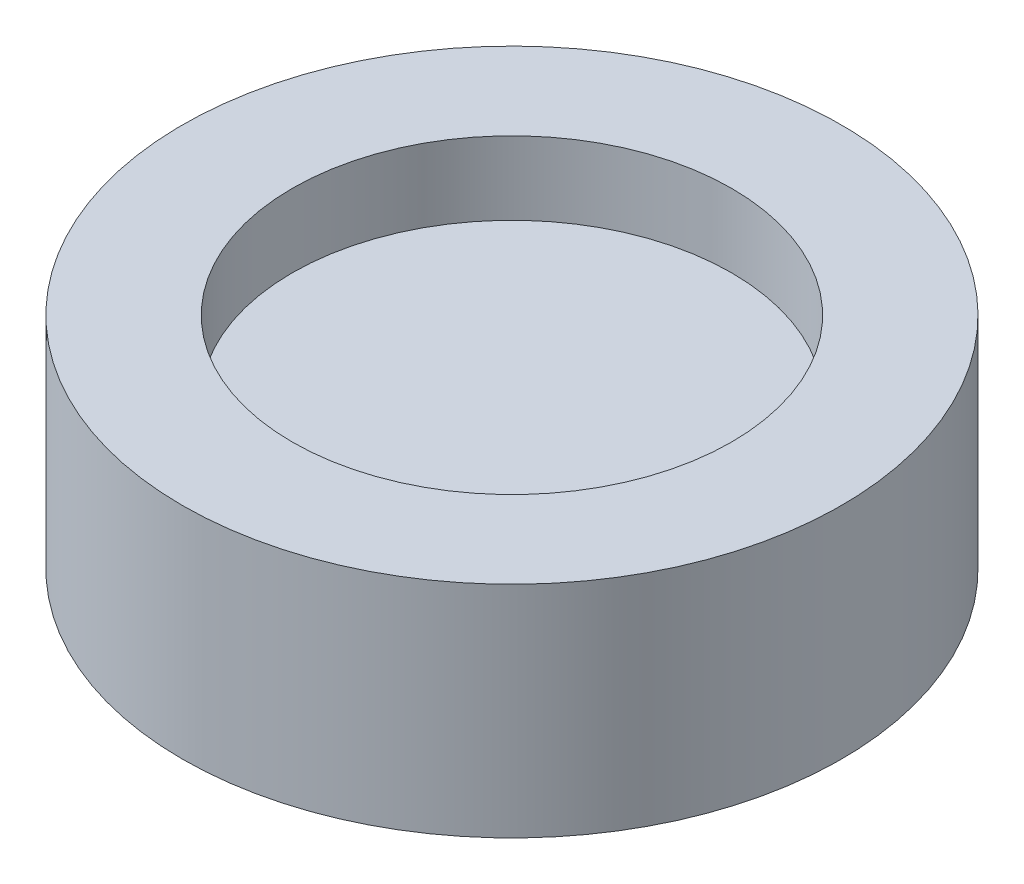
from build123d import *

# Parameters (mm, degrees)
SKETCH1_R           = 38.1
BOSS_EXTRUDE1_DEPTH = 25.4
SKETCH2_R           = 25.4
CUT_EXTRUDE1_DEPTH  = 8.4582


with BuildPart() as part:
    # Sketch1 → Boss-Extrude1 (new body)
    with BuildSketch(Plane(origin=(0, 0, 0), x_dir=(1, 0, 0), z_dir=(0, 1, 0))):
        Circle(SKETCH1_R)
    extrude(amount=-BOSS_EXTRUDE1_DEPTH)

    # Sketch2 → Cut-Extrude1 (cut)
    with BuildSketch(Plane(origin=(0, 0, 0), x_dir=(1, 0, 0), z_dir=(0, 1, 0))):
        Circle(SKETCH2_R)
    extrude(amount=-CUT_EXTRUDE1_DEPTH, mode=Mode.SUBTRACT)


solid = part.part
